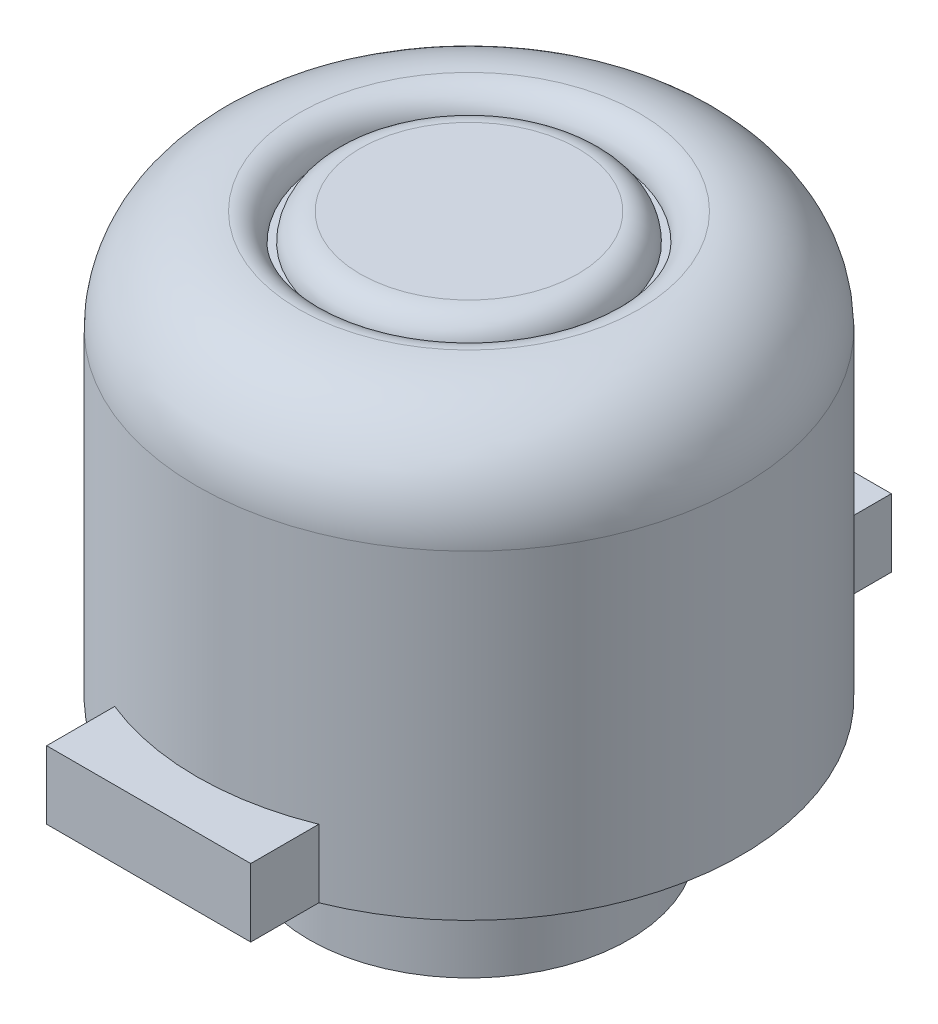
from build123d import *

# Parameters (mm, degrees)
SKETCH3_W                = 3
SKETCH3_H                = 1
BOSS_EXTRUDE2_DEPTH      = 1
FILLET1_R                = 1.5
SKETCH5_R                = 2.1
SKETCH5_R_2              = 2
CUT_EXTRUDE1_DEPTH       = 0.4
FILLET2_R                = 0.4
BOSS_EXTRUDE3_DEPTH      = 1.9
BOSS_EXTRUDE3_DEPTH_BACK = 4.4
SKETCH6_R                = 2.35


with BuildPart() as part:
    # Sketch1 → Revolve1 (revolve)
    with BuildSketch(Plane.XY, mode=Mode.PRIVATE) as revolve1_sk:
        Polygon((4, 0), (2.35, 0), (2.35, 5.4), (0, 5.4), (0, 6.2), (4, 6.2), align=None)
    revolve(revolve1_sk.sketch.rotate(Axis((0, 0, 0), (0, 1, 0)), 90), axis=Axis((0, 0, 0), (0, 1, 0)))

    # Sketch3 → Boss-Extrude2 (add)
    with BuildSketch(Plane(origin=(0, 0, 0), x_dir=(1, 0, 0), z_dir=(0, 1, 0))):
        with Locations((0, -4.208099244)):
            Rectangle(SKETCH3_W, SKETCH3_H)
    boss_extrude2 = extrude(amount=BOSS_EXTRUDE2_DEPTH)

    # Mirror2: Boss-Extrude2 across plane
    add(boss_extrude2.mirror(Plane.XY))

    # Fillet1
    fillet1_edges = [part.edges().sort_by_distance(p)[0] for p in [
        (0, 6.2, 4),
    ]]
    fillet(fillet1_edges, radius=FILLET1_R)

    # Sketch5 → Cut-Extrude1 (cut)
    with BuildSketch(Plane(origin=(0, 6.2, 0), x_dir=(1, 0, 0), z_dir=(0, 1, 0))):
        with Locations(Location((0, 0, 0), (0, 0, 270))):
            Circle(SKETCH5_R)
        with Locations(Location((0, 0, 0), (0, 0, 270))):
            Circle(SKETCH5_R_2, mode=Mode.SUBTRACT)
    extrude(amount=-CUT_EXTRUDE1_DEPTH, mode=Mode.SUBTRACT)

    # Fillet2
    fillet2_edges = [part.edges().sort_by_distance(p)[0] for p in [
        (0, 6.2, -2.1),
        (0, 6.2, -2),
    ]]
    fillet(fillet2_edges, radius=FILLET2_R - 0.0001)  # a hair under: the kernel refuses the full size

    # Sketch6 → Boss-Extrude3 (add, two sides: drawn at the far end of the back side and taken through both)
    with BuildSketch(Plane.XZ.offset(-BOSS_EXTRUDE3_DEPTH_BACK)):
        with Locations(Location((0, 0, 0), (0, 0, 270))):
            Circle(SKETCH6_R)
    extrude(amount=BOSS_EXTRUDE3_DEPTH + BOSS_EXTRUDE3_DEPTH_BACK)


solid = part.part
